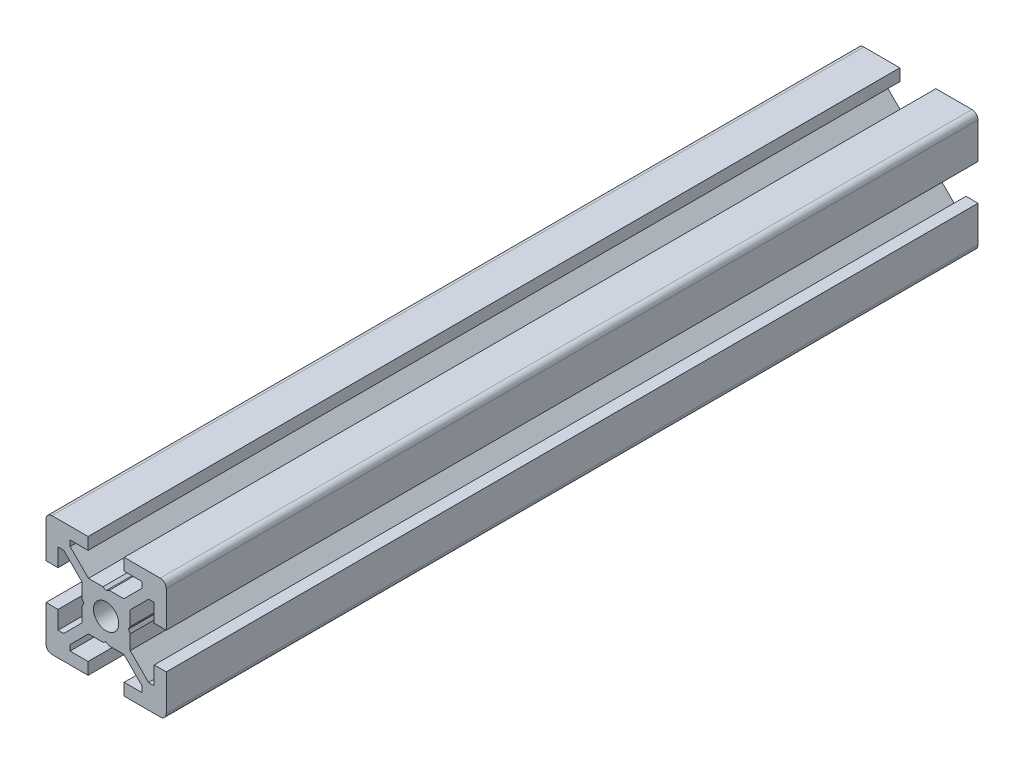
from build123d import *

# Parameters (mm, degrees)
BOSS_EXTRUDE1_DEPTH = 135
SKETCH2_W           = 135
SKETCH2_H           = 2.1


with BuildPart() as part:
    # Sketch1 → Boss-Extrude1 (new body)
    with BuildSketch(Plane.XY):
        with BuildLine():
            Line((-10, -3), (-10, -9))
            ThreePointArc((-10, -9), (-9.707106781, -9.707106781), (-9, -10))
            Line((-9, -10), (-3, -10))
            Line((-3, -10), (-3, -8))
            Line((-3, -8), (-6, -8))
            Line((-6, -8), (-6, -7.060660172))
            Line((-6, -7.060660172), (-2.939339828, -4))
            Line((-2.939339828, -4), (-0.519615242, -4))
            Line((-0.519615242, -4), (0, -3.7))
            Line((0, -3.7), (0.519615242, -4))
            Line((0.519615242, -4), (2.939339828, -4))
            Line((2.939339828, -4), (6, -7.060660172))
            Line((6, -7.060660172), (6, -8))
            Line((6, -8), (3, -8))
            Line((3, -8), (3, -10))
            Line((3, -10), (9, -10))
            ThreePointArc((9, -10), (9.707106781, -9.707106781), (10, -9))
            Line((10, -9), (10, -3))
            Line((10, -3), (8, -3))
            Line((8, -3), (8, -6))
            Line((8, -6), (7.060660172, -6))
            Line((7.060660172, -6), (4, -2.939339828))
            Line((4, -2.939339828), (4, -0.519615242))
            Line((4, -0.519615242), (3.7, 0))
            Line((3.7, 0), (4, 0.519615242))
            Line((4, 0.519615242), (4, 2.939339828))
            Line((4, 2.939339828), (7.060660172, 6))
            Line((7.060660172, 6), (8, 6))
            Line((8, 6), (8, 3))
            Line((8, 3), (10, 3))
            Line((10, 3), (10, 9))
            ThreePointArc((10, 9), (9.707106781, 9.707106781), (9, 10))
            Line((9, 10), (3, 10))
            Line((3, 10), (3, 8))
            Line((3, 8), (6, 8))
            Line((6, 8), (6, 7.060660172))
            Line((6, 7.060660172), (2.939339828, 4))
            Line((2.939339828, 4), (0.519615242, 4))
            Line((0.519615242, 4), (0, 3.7))
            Line((0, 3.7), (-0.519615242, 4))
            Line((-0.519615242, 4), (-2.939339828, 4))
            Line((-2.939339828, 4), (-6, 7.060660172))
            Line((-6, 7.060660172), (-6, 8))
            Line((-6, 8), (-3, 8))
            Line((-3, 8), (-3, 10))
            Line((-3, 10), (-9, 10))
            ThreePointArc((-9, 10), (-9.707106781, 9.707106781), (-10, 9))
            Line((-10, 9), (-10, 3))
            Line((-10, 3), (-8, 3))
            Line((-8, 3), (-8, 6))
            Line((-8, 6), (-7.060660172, 6))
            Line((-7.060660172, 6), (-4, 2.939339828))
            Line((-4, 2.939339828), (-4, 0.519615242))
            Line((-4, 0.519615242), (-3.7, 0))
            Line((-3.7, 0), (-4, -0.519615242))
            Line((-4, -0.519615242), (-4, -2.939339828))
            Line((-4, -2.939339828), (-7.060660172, -6))
            Line((-7.060660172, -6), (-8, -6))
            Line((-8, -6), (-8, -3))
            Line((-8, -3), (-10, -3))
        make_face()
    extrude(amount=-BOSS_EXTRUDE1_DEPTH)

    # Sketch2 → Cut-Revolve1 (revolve, cut)
    with BuildSketch(Plane(origin=(0, 0, 0), x_dir=(0, 0, -1), z_dir=(1, 0, 0))):
        with Locations((67.5, 1.05)):
            Rectangle(SKETCH2_W, SKETCH2_H)
    revolve(axis=Axis((0, 0, -135), (0, 0, 1)), mode=Mode.SUBTRACT)


solid = part.part
